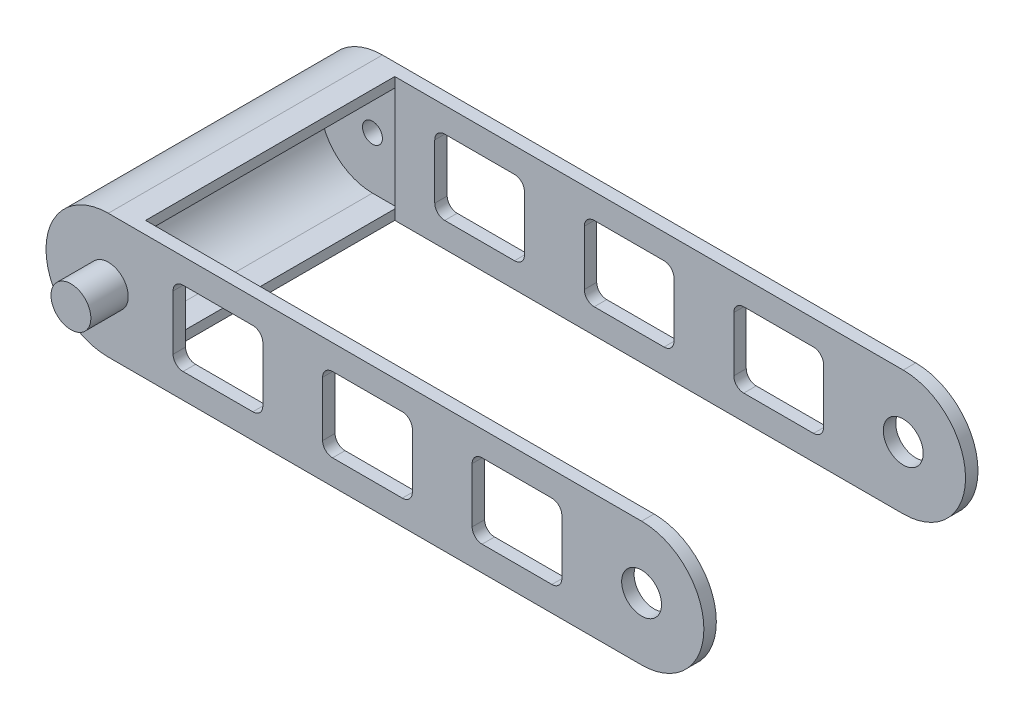
from build123d import *

# Parameters (mm, degrees)
SKETCH1_R              = 4
BOSS_EXTRUDE1_DEPTH    = 27.5
SKETCH2_W              = 61.091432286
SKETCH2_H              = 28.689736928
CUT_EXTRUDE1_DEPTH     = 25
SKETCH3_R              = 4
BOSS_EXTRUDE2_DEPTH    = 35
SKETCH4_W              = 71.474314091
SKETCH4_H              = 50
CUT_EXTRUDE2_DEPTH     = 79.778169565
SHELL1_START           = -25.5
SHELL1_DEPTH           = 51
SHELL1_START_2         = -33
SHELL1_2_OUTLINE_R     = 2
SHELL1_2_DEPTH         = 66
SKETCH5_W              = 18
SKETCH5_H              = 15
CUT_EXTRUDE3_DEPTH     = 92.752384165
FILLET1_R              = 2
LPATTERN1_COUNT        = 3
LPATTERN1_PITCH        = 30
FILLET1_OF_LPATTERN1_R = 2


# Read off the part's stored shape, not the designer's step: Shell1
with BuildPart() as part:
    # Sketch1 → Boss-Extrude1 (new, symmetric)
    with BuildSketch(Plane.XY):
        with BuildLine():
            Line((-53.5, 12.5), (53.5, 12.5))
            ThreePointArc((53.5, 12.5), (66, 0), (53.5, -12.5))
            Line((53.5, -12.5), (-53.5, -12.5))
            ThreePointArc((-53.5, -12.5), (-66, 0), (-53.5, 12.5))
        make_face()
        with Locations((53.5, 0)):
            Circle(SKETCH1_R, mode=Mode.SUBTRACT)
    extrude(amount=BOSS_EXTRUDE1_DEPTH, both=True)

    # Sketch2 → Cut-Extrude1 (cut, symmetric)
    with BuildSketch(Plane.XY):
        with Locations((53.5, 0)):
            Rectangle(SKETCH2_W, SKETCH2_H)
    extrude(amount=CUT_EXTRUDE1_DEPTH, both=True, mode=Mode.SUBTRACT)

    # Sketch3 → Boss-Extrude2 (add, symmetric)
    with BuildSketch(Plane.XY):
        with Locations((-53.5, 0)):
            Circle(SKETCH3_R)
    extrude(amount=BOSS_EXTRUDE2_DEPTH, both=True)

    # Sketch4 → Cut-Extrude2 (cut, through all)
    with BuildSketch(Plane(origin=(0, 12.5, 0), x_dir=(1, 0, 0), z_dir=(0, 1, 0))):
        with Locations((-12.782873189, 0)):
            Rectangle(SKETCH4_W, SKETCH4_H)
    extrude(amount=-CUT_EXTRUDE2_DEPTH, mode=Mode.SUBTRACT)

    # Shell1 outline → Shell1 (cut)
    with BuildSketch(Plane.XY.offset(SHELL1_START)):
        with BuildLine():
            Line((-48.520030234, -10.5), (-48.520030234, 10.5))
            Line((-48.520030234, 10.5), (-53.5, 10.5))
            ThreePointArc((-53.5, 10.5), (-64, 0), (-53.5, -10.5))
            Line((-53.5, -10.5), (-48.520030234, -10.5))
        make_face()
    extrude(amount=SHELL1_DEPTH, mode=Mode.SUBTRACT)

    # Shell1 2 outline → Shell1 2 (cut)
    with BuildSketch(Plane.XY.offset(SHELL1_START_2)):
        with Locations((-53.5, 0)):
            Circle(SHELL1_2_OUTLINE_R)
    extrude(amount=SHELL1_2_DEPTH, mode=Mode.SUBTRACT)

    # Sketch5 → Cut-Extrude3 (cut, through all)
    with BuildSketch(Plane.XY.offset(27.5)):
        with Locations((-31.5, 0)):
            Rectangle(SKETCH5_W, SKETCH5_H)
    cut_extrude3 = extrude(amount=-CUT_EXTRUDE3_DEPTH, mode=Mode.SUBTRACT)

    # Fillet1
    fillet1_edges = [part.edges().sort_by_distance(p)[0] for p in [
        (-40.5, -7.5, -26.25),
        (-40.5, -7.5, 26.25),
        (-40.5, 7.5, -26.25),
        (-40.5, 7.5, 26.25),
        (-22.5, 7.5, -26.25),
        (-22.5, 7.5, 26.25),
        (-22.5, -7.5, -26.25),
        (-22.5, -7.5, 26.25),
    ]]
    fillet(fillet1_edges, radius=FILLET1_R)

    # LPattern1: Cut-Extrude3 ×3
    with Locations(*[(i * LPATTERN1_PITCH, 0, 0) for i in range(1, LPATTERN1_COUNT)]):
        add(cut_extrude3, mode=Mode.SUBTRACT)

    # Fillet1 of LPattern1
    fillet1_of_lpattern1_edges = [part.edges().sort_by_distance(p)[0] for p in [
        (-10.5, -7.5, -26.25),
        (-10.5, -7.5, 26.25),
        (-10.5, 7.5, -26.25),
        (-10.5, 7.5, 26.25),
        (7.5, 7.5, -26.25),
        (7.5, 7.5, 26.25),
        (7.5, -7.5, -26.25),
        (7.5, -7.5, 26.25),
        (19.5, -7.5, -26.25),
        (19.5, -7.5, 26.25),
        (19.5, 7.5, -26.25),
        (19.5, 7.5, 26.25),
        (37.5, 7.5, -26.25),
        (37.5, 7.5, 26.25),
        (37.5, -7.5, -26.25),
        (37.5, -7.5, 26.25),
    ]]
    fillet(fillet1_of_lpattern1_edges, radius=FILLET1_OF_LPATTERN1_R)


solid = part.part
